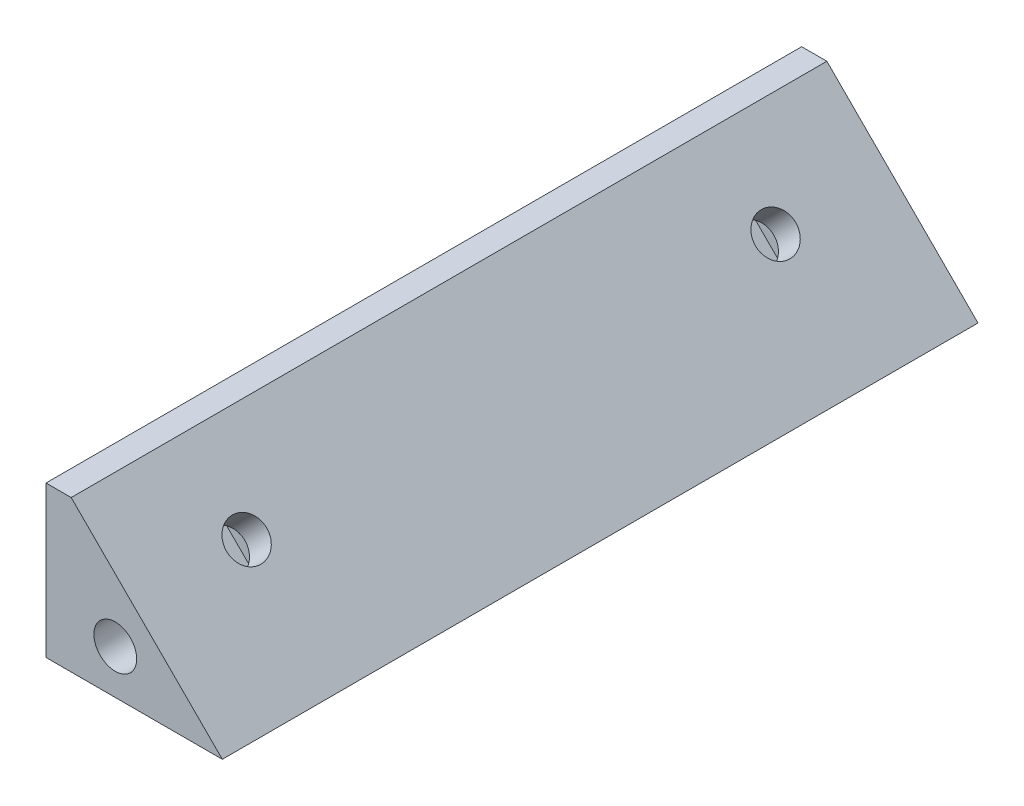
from build123d import *

# Parameters (mm, degrees)
BOSS_EXTRUDE1_DEPTH     = 30
SKETCH1_13_W            = 2
SKETCH1_13_H            = 12
BOSS_EXTRUDE6_DEPTH     = 30
CUT_EXTRUDE3_DEPTH      = 5
BOSS_EXTRUDE4_START     = -2.45
BOSS_EXTRUDE4_OUTLINE_W = 30
BOSS_EXTRUDE4_OUTLINE_H = 14.485281374
BOSS_EXTRUDE4_OUTLINE_R = 1.6
BOSS_EXTRUDE4_DEPTH     = 2.45
CUT_EXTRUDE1_DEPTH      = 5
SKETCH1_10_R            = 1.7
BOSS_EXTRUDE5_DEPTH     = 2.45
CUT_EXTRUDE4_DEPTH      = 63.353829072


# Read off the part's stored shape, not the designer's step: Boss-Extrude4
with BuildPart() as part:
    # Sketch1 → Boss-Extrude1 (new body)
    with BuildSketch(Plane.XY):
        Polygon((0, 12), (12, 0), (0, 0), align=None)
    boss_extrude1 = extrude(amount=BOSS_EXTRUDE1_DEPTH)

    # Sketch1<13> → Boss-Extrude6 (add)
    with BuildSketch(Plane.XY):
        with Locations((-1, 6)):
            Rectangle(SKETCH1_13_W, SKETCH1_13_H)
    boss_extrude6 = extrude(amount=BOSS_EXTRUDE6_DEPTH)

    # Sketch4 → Cut-Extrude3 (cut)
    with BuildSketch(Plane(origin=(6, 6, 0), x_dir=(0, 0, -1), z_dir=(0.7071067811865477, 0.7071067811865475, 0))):
        Polygon((-6.175, -8.485281374), (-6.175, 3.145733136), (-9, 4.776747647), (-11.825, 3.145733136), (-11.825, -8.485281374), align=None)
    cut_extrude3 = extrude(amount=-CUT_EXTRUDE3_DEPTH, mode=Mode.SUBTRACT)

    # Boss-Extrude4 outline → Boss-Extrude4 (add)
    with BuildSketch(Plane(origin=(6, 6, 0), x_dir=(0, 0, -1), z_dir=(0.7071067811865477, 0.7071067811865475, 0)).offset(BOSS_EXTRUDE4_START)):
        with Locations((-15, -1.242640687)):
            Rectangle(BOSS_EXTRUDE4_OUTLINE_W, BOSS_EXTRUDE4_OUTLINE_H)
        with Locations((-9, 1.514718626)):
            Circle(BOSS_EXTRUDE4_OUTLINE_R, mode=Mode.SUBTRACT)
    boss_extrude4 = extrude(amount=BOSS_EXTRUDE4_DEPTH)

    # Sketch1<4> → Cut-Extrude1 (cut)
    with BuildSketch(Plane.XY):
        Polygon((10.669337222, 0), (4.440608352, 6.623473909), (1.265296423, 5.876327682), (0.324688071, 2.752853773), (2.91347758, 0), align=None)
    cut_extrude1 = extrude(amount=CUT_EXTRUDE1_DEPTH, mode=Mode.SUBTRACT)

    # Sketch1<10> → Boss-Extrude5 (add)
    # profile 1 of 2: a face of its own
    with BuildSketch(Plane.XY):
        Polygon((2.559391648, 0.376526091), (5.734703577, 1.123672318), (6.675311929, 4.247146227), (4.440608352, 6.623473909), (1.265296423, 5.876327682), (0.324688071, 2.752853773), align=None)
        with Locations((3.5, 3.5)):
            Circle(SKETCH1_10_R, mode=Mode.SUBTRACT)
    # profile 2 of 2: a face of its own
    with BuildSketch(Plane.XY):
        Polygon((3.5, 0), (10.669337222, 0), (6.675311929, 4.247146227), (5.734703577, 1.123672318), (2.559391648, 0.376526091), (2.91347758, 0), align=None)
    boss_extrude5 = extrude(amount=BOSS_EXTRUDE5_DEPTH)

    # Mirror1: Boss-Extrude1, Boss-Extrude6, Cut-Extrude3, Boss-Extrude4, Cut-Extrude1, Boss-Extrude5 across plane
    add(boss_extrude1.mirror(Plane.XY.offset(30)))
    add(boss_extrude6.mirror(Plane.XY.offset(30)))
    add(cut_extrude3.mirror(Plane.XY.offset(30)), mode=Mode.SUBTRACT)
    add(boss_extrude4.mirror(Plane.XY.offset(30)))
    add(cut_extrude1.mirror(Plane.XY.offset(30)), mode=Mode.SUBTRACT)
    add(boss_extrude5.mirror(Plane.XY.offset(30)))

    # Sketch1<12> → Cut-Extrude4 (cut, through all)
    with BuildSketch(Plane.XY):
        Polygon((12, -3.5), (12, 0), (10.669337222, 0), (3.5, 0), (2.91347758, 0), (1.441458618, 0), (0, 0), (0, -3.5), align=None)
    extrude(amount=CUT_EXTRUDE4_DEPTH, mode=Mode.SUBTRACT)


solid = part.part
